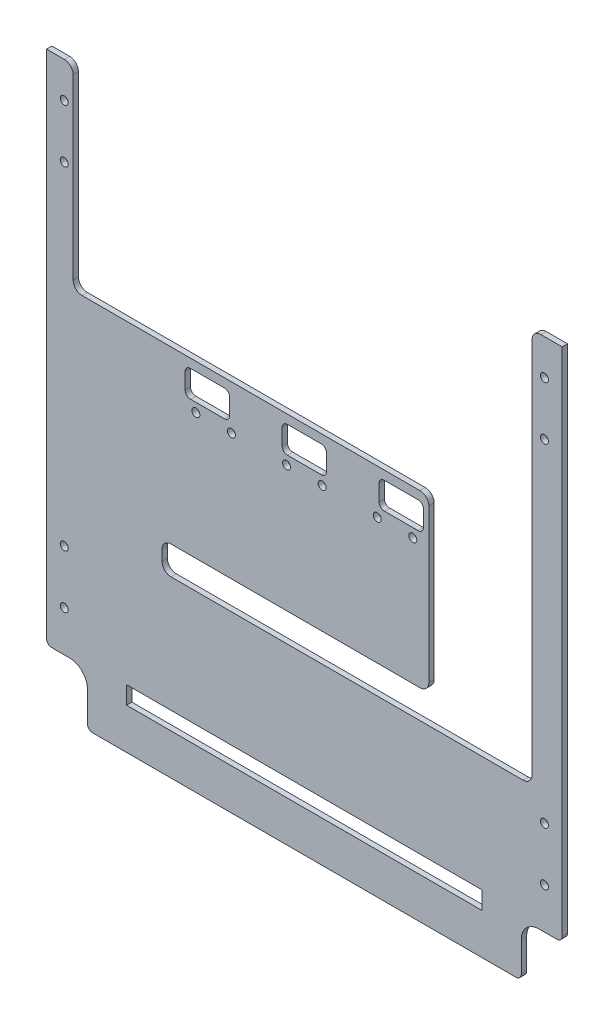
from build123d import *

# Parameters (mm, degrees)
ESQUISSE1_W                  = 290
ESQUISSE1_H                  = 320
BOSS_EXTRU_1_DEPTH           = 3
ENL_V_MAT_EXTRU_1_DEPTH      = 432.866877637
ENL_V_MAT_EXTRU_1_DEPTH_BACK = 432.866877637
ESQUISSE2_W                  = 23
ESQUISSE2_H                  = 30
CONG_1_R                     = 10
CONG_2_R                     = 3
ENL_V_MAT_EXTRU_2_DEPTH      = 432.866877637
ENL_V_MAT_EXTRU_2_DEPTH_BACK = 432.866877637
ESQUISSE3_W                  = 140
ESQUISSE3_H                  = 110
ENL_V_MAT_EXTRU_3_DEPTH      = 432.866877637
ENL_V_MAT_EXTRU_3_DEPTH_BACK = 432.866877637
ESQUISSE4_W                  = 58
ESQUISSE4_H                  = 222
ENL_V_MAT_EXTRU_4_DEPTH      = 432.866877637
ENL_V_MAT_EXTRU_4_DEPTH_BACK = 432.866877637
ESQUISSE5_W                  = 60
ESQUISSE5_H                  = 110
ENL_V_MAT_EXTRU_5_DEPTH      = 432.866877637
ENL_V_MAT_EXTRU_5_DEPTH_BACK = 432.866877637
ESQUISSE6_W                  = 150
ESQUISSE6_H                  = 16
CONG_3_R                     = 5
ENL_V_MAT_EXTRU_6_DEPTH      = 432.866877637
ENL_V_MAT_EXTRU_6_DEPTH_BACK = 432.866877637
ESQUISSE7_R                  = 2.25
ENL_V_MAT_EXTRU_7_DEPTH      = 432.866877637
ENL_V_MAT_EXTRU_7_DEPTH_BACK = 432.866877637
ESQUISSE8_R                  = 2.25
ENL_V_MAT_EXTRU_8_DEPTH      = 432.866877637
ENL_V_MAT_EXTRU_8_DEPTH_BACK = 432.866877637
ESQUISSE9_W                  = 25
ESQUISSE9_H                  = 15
CONG_4_R                     = 3
ENL_V_MAT_EXTRU_9_DEPTH      = 432.866877637
ENL_V_MAT_EXTRU_9_DEPTH_BACK = 432.866877637
ESQUISSE10_W                 = 200
ESQUISSE10_H                 = 10


with BuildPart() as part:
    # Esquisse1 → Boss.-Extru.1 (new body)
    with BuildSketch(Plane.XY):
        with Locations((145, 160)):
            Rectangle(ESQUISSE1_W, ESQUISSE1_H)
    extrude(amount=BOSS_EXTRU_1_DEPTH)

    # Esquisse2 → Enlèv. mat.-Extru.1 (cut, two sides: drawn at the far end of the back side and taken through both)
    with BuildSketch(Plane.XY.offset(3).offset(-ENL_V_MAT_EXTRU_1_DEPTH_BACK)):
        with Locations((278.5, 15)):
            Rectangle(ESQUISSE2_W, ESQUISSE2_H)
        with Locations((11.5, 15)):
            Rectangle(ESQUISSE2_W, ESQUISSE2_H)
    extrude(amount=ENL_V_MAT_EXTRU_1_DEPTH + ENL_V_MAT_EXTRU_1_DEPTH_BACK, mode=Mode.SUBTRACT)

    # Congé1
    cong_1_edges = [part.edges().sort_by_distance(p)[0] for p in [
        (267, 30, 1.5),
        (23, 30, 1.5),
    ]]
    fillet(cong_1_edges, radius=CONG_1_R)

    # Congé2
    cong_2_edges = [part.edges().sort_by_distance(p)[0] for p in [
        (290, 30, 1.5),
        (0, 30, 1.5),
        (23, 0, 1.5),
        (267, 0, 1.5),
    ]]
    fillet(cong_2_edges, radius=CONG_2_R)

    # Esquisse3 → Enlèv. mat.-Extru.2 (cut, two sides: drawn at the far end of the back side and taken through both)
    with BuildSketch(Plane.XY.offset(3).offset(-ENL_V_MAT_EXTRU_2_DEPTH_BACK)):
        with Locations((145, 265)):
            Rectangle(ESQUISSE3_W, ESQUISSE3_H)
    extrude(amount=ENL_V_MAT_EXTRU_2_DEPTH + ENL_V_MAT_EXTRU_2_DEPTH_BACK, mode=Mode.SUBTRACT)

    # Esquisse4 → Enlèv. mat.-Extru.3 (cut, two sides: drawn at the far end of the back side and taken through both)
    with BuildSketch(Plane.XY.offset(3).offset(-ENL_V_MAT_EXTRU_3_DEPTH_BACK)):
        with Locations((244, 209)):
            Rectangle(ESQUISSE4_W, ESQUISSE4_H)
    extrude(amount=ENL_V_MAT_EXTRU_3_DEPTH + ENL_V_MAT_EXTRU_3_DEPTH_BACK, mode=Mode.SUBTRACT)

    # Esquisse5 → Enlèv. mat.-Extru.4 (cut, two sides: drawn at the far end of the back side and taken through both)
    with BuildSketch(Plane.XY.offset(3).offset(-ENL_V_MAT_EXTRU_4_DEPTH_BACK)):
        with Locations((45, 265)):
            Rectangle(ESQUISSE5_W, ESQUISSE5_H)
    extrude(amount=ENL_V_MAT_EXTRU_4_DEPTH + ENL_V_MAT_EXTRU_4_DEPTH_BACK, mode=Mode.SUBTRACT)

    # Esquisse6 → Enlèv. mat.-Extru.5 (cut, two sides: drawn at the far end of the back side and taken through both)
    with BuildSketch(Plane.XY.offset(3).offset(-ENL_V_MAT_EXTRU_5_DEPTH_BACK)):
        with Locations((140, 106)):
            Rectangle(ESQUISSE6_W, ESQUISSE6_H)
    extrude(amount=ENL_V_MAT_EXTRU_5_DEPTH + ENL_V_MAT_EXTRU_5_DEPTH_BACK, mode=Mode.SUBTRACT)

    # Congé3
    cong_3_edges = [part.edges().sort_by_distance(p)[0] for p in [
        (273, 98, 1.5),
        (65, 98, 1.5),
        (65, 114, 1.5),
        (215, 114, 1.5),
        (215, 210, 1.5),
        (15, 210, 1.5),
        (273, 320, 1.5),
        (15, 320, 1.5),
    ]]
    fillet(cong_3_edges, radius=CONG_3_R)

    # Esquisse7 → Enlèv. mat.-Extru.6 (cut, two sides: drawn at the far end of the back side and taken through both)
    with BuildSketch(Plane.XY.offset(3).offset(-ENL_V_MAT_EXTRU_6_DEPTH_BACK)):
        with Locations((280, 300)):
            Circle(ESQUISSE7_R)
        with Locations((280, 270)):
            Circle(ESQUISSE7_R)
        with Locations((10, 270)):
            Circle(ESQUISSE7_R)
        with Locations((10, 300)):
            Circle(ESQUISSE7_R)
        with Locations((280, 83)):
            Circle(ESQUISSE7_R)
        with Locations((280, 53)):
            Circle(ESQUISSE7_R)
        with Locations((10, 53)):
            Circle(ESQUISSE7_R)
        with Locations((10, 83)):
            Circle(ESQUISSE7_R)
    extrude(amount=ENL_V_MAT_EXTRU_6_DEPTH + ENL_V_MAT_EXTRU_6_DEPTH_BACK, mode=Mode.SUBTRACT)

    # Esquisse8 → Enlèv. mat.-Extru.7 (cut, two sides: drawn at the far end of the back side and taken through both)
    with BuildSketch(Plane.XY.offset(3).offset(-ENL_V_MAT_EXTRU_7_DEPTH_BACK)):
        with Locations((135, 185)):
            Circle(ESQUISSE8_R)
        with Locations((155, 185)):
            Circle(ESQUISSE8_R)
        with Locations((186, 185)):
            Circle(ESQUISSE8_R)
        with Locations((206, 185)):
            Circle(ESQUISSE8_R)
        with Locations((84, 185)):
            Circle(ESQUISSE8_R)
        with Locations((104, 185)):
            Circle(ESQUISSE8_R)
    extrude(amount=ENL_V_MAT_EXTRU_7_DEPTH + ENL_V_MAT_EXTRU_7_DEPTH_BACK, mode=Mode.SUBTRACT)

    # Esquisse9 → Enlèv. mat.-Extru.8 (cut, two sides: drawn at the far end of the back side and taken through both)
    with BuildSketch(Plane.XY.offset(3).offset(-ENL_V_MAT_EXTRU_8_DEPTH_BACK)):
        with Locations((145, 197.5)):
            Rectangle(ESQUISSE9_W, ESQUISSE9_H)
        with Locations((199.5, 197.5)):
            Rectangle(ESQUISSE9_W, ESQUISSE9_H)
        with Locations((90.5, 197.5)):
            Rectangle(ESQUISSE9_W, ESQUISSE9_H)
    extrude(amount=ENL_V_MAT_EXTRU_8_DEPTH + ENL_V_MAT_EXTRU_8_DEPTH_BACK, mode=Mode.SUBTRACT)

    # Congé4
    cong_4_edges = [part.edges().sort_by_distance(p)[0] for p in [
        (157.5, 190, 1.5),
        (157.5, 205, 1.5),
        (132.5, 205, 1.5),
        (132.5, 190, 1.5),
        (212, 190, 1.5),
        (212, 205, 1.5),
        (187, 205, 1.5),
        (187, 190, 1.5),
        (103, 190, 1.5),
        (103, 205, 1.5),
        (78, 205, 1.5),
        (78, 190, 1.5),
    ]]
    fillet(cong_4_edges, radius=CONG_4_R)

    # Esquisse10 → Enlèv. mat.-Extru.9 (cut, two sides: drawn at the far end of the back side and taken through both)
    with BuildSketch(Plane.XY.offset(3).offset(-ENL_V_MAT_EXTRU_9_DEPTH_BACK)):
        with Locations((145, 28)):
            Rectangle(ESQUISSE10_W, ESQUISSE10_H)
    extrude(amount=ENL_V_MAT_EXTRU_9_DEPTH + ENL_V_MAT_EXTRU_9_DEPTH_BACK, mode=Mode.SUBTRACT)


solid = part.part
